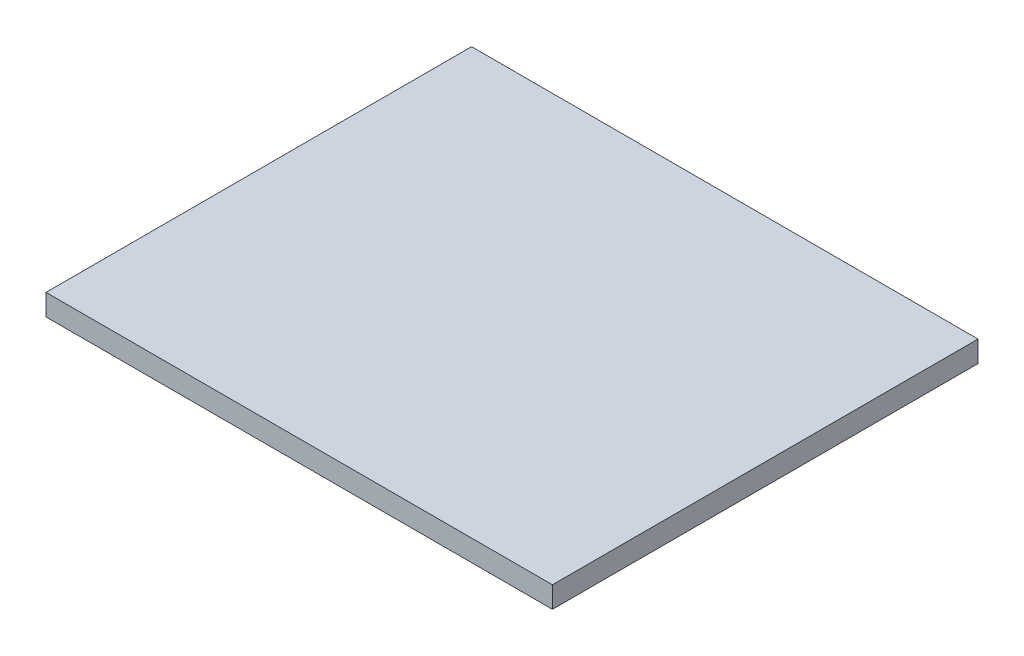
from build123d import *

# Parameters (mm, degrees)
SKETCH1_W           = 59.5
SKETCH1_H           = 50
SKETCH1_R           = 3
BOSS_EXTRUDE1_DEPTH = 1.5
BOSS_EXTRUDE2_DEPTH = 50
CUT_EXTRUDE1_DEPTH  = 2
CHAMFER1_SIZE       = 2
SKETCH4_W           = 59.5
SKETCH4_H           = 1.892701509
CUT_EXTRUDE2_DEPTH  = 59.318629099


with BuildPart() as part:
    # Sketch1 → Boss-Extrude1 (new body)
    with BuildSketch(Plane(origin=(0, 0, 0), x_dir=(1, 0, 0), z_dir=(0, 1, 0))):
        Rectangle(SKETCH1_W, SKETCH1_H)
        with Locations(Location((0, 0, 0), (0, 0, 270))):
            Circle(SKETCH1_R, mode=Mode.SUBTRACT)
    extrude(amount=BOSS_EXTRUDE1_DEPTH)

    # Sketch2 → Boss-Extrude2 (add)
    with BuildSketch(Plane(origin=(0, 0, -25), x_dir=(-1, 0, 0), z_dir=(0, 0, -1))):
        Polygon((-29.75, 1.5), (29.75, 1.5), (29.75, 2.5), (28.56, 4), (27.37, 2.5), (26.18, 4), (24.99, 2.5), (23.8, 4), (22.61, 2.5), (21.42, 4), (20.23, 2.5), (19.04, 4), (17.85, 2.5), (16.66, 4), (15.47, 2.5), (14.28, 4), (13.09, 2.5), (11.9, 4), (10.71, 2.5), (9.52, 4), (8.33, 2.5), (7.14, 4), (5.95, 2.5), (4.76, 4), (3.57, 2.5), (2.38, 4), (1.19, 2.5), (0, 4), (-1.19, 2.5), (-2.38, 4), (-3.57, 2.5), (-4.76, 4), (-5.95, 2.5), (-7.14, 4), (-8.33, 2.5), (-9.52, 4), (-10.71, 2.5), (-11.9, 4), (-13.09, 2.5), (-14.28, 4), (-15.47, 2.5), (-16.66, 4), (-17.85, 2.5), (-19.04, 4), (-20.23, 2.5), (-21.42, 4), (-22.61, 2.5), (-23.8, 4), (-24.99, 2.5), (-26.18, 4), (-27.37, 2.5), (-28.56, 4), (-29.75, 2.5), align=None)
    extrude(amount=-BOSS_EXTRUDE2_DEPTH)

    # Sketch3 → Cut-Extrude1 (cut)
    with BuildSketch(Plane(origin=(0, 0, 0), x_dir=(-1, 0, 0), z_dir=(0, -1, 0))):
        with BuildLine():
            Line((-1.75, -2.436698586), (-1.75, -5))
            Line((-1.75, -5), (1.75, -5))
            Line((1.75, -5), (1.75, -2.436698586))
            ThreePointArc((1.75, -2.436698586), (0, 3), (-1.75, -2.436698586))
        make_face()
    extrude(amount=-CUT_EXTRUDE1_DEPTH, mode=Mode.SUBTRACT)

    # Chamfer1
    chamfer1_edges = [part.edges().sort_by_distance(p)[0] for p in [
        (0, 0, 5),
    ]]
    chamfer(chamfer1_edges, length=CHAMFER1_SIZE - 0.0001)  # a hair under: the kernel refuses the full size

    # Sketch4 → Cut-Extrude2 (cut, through all)
    with BuildSketch(Plane.XY.offset(25)):
        with Locations((0, 3.446350755)):
            Rectangle(SKETCH4_W, SKETCH4_H)
    extrude(amount=-CUT_EXTRUDE2_DEPTH, mode=Mode.SUBTRACT)


solid = part.part
